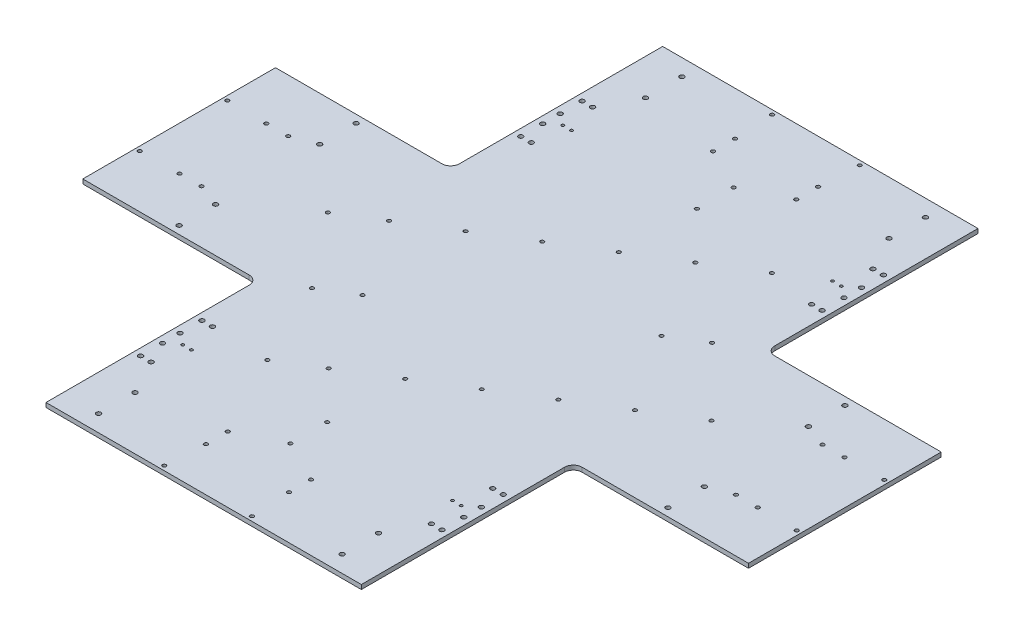
from build123d import *

# Parameters (mm, degrees)
BOSS_EXTRUDE1_DEPTH = 5
SKETCH2_R           = 2.125
CUT_EXTRUDE1_DEPTH  = 3
SKETCH4_R           = 2.6
SKETCH4_R_2         = 1.6
CUT_EXTRUDE3_DEPTH  = 10
SKETCH5_R           = 2.1
CUT_EXTRUDE4_DEPTH  = 10
FILLET1_R           = 10
SKETCH6_R           = 2.6
CUT_EXTRUDE5_DEPTH  = 10
SKETCH7_R           = 2.1
CUT_EXTRUDE6_DEPTH  = 10
SKETCH8_R           = 2.1
CUT_EXTRUDE7_DEPTH  = 10


with BuildPart() as part:
    # Sketch1 → Boss-Extrude1 (new body)
    with BuildSketch(Plane(origin=(0, 0, 0), x_dir=(1, 0, 0), z_dir=(0, 1, 0))):
        Polygon((180, 352), (-180, 352), (-180, 110), (-380, 110), (-380, -110), (-180, -110), (-180, -352), (180, -352), (180, -110), (380, -110), (380, 110), (180, 110), align=None)
    extrude(amount=BOSS_EXTRUDE1_DEPTH)

    # Sketch2 → Cut-Extrude1 (cut)
    with BuildSketch(Plane(origin=(0, 5, 0), x_dir=(1, 0, 0), z_dir=(0, 1, 0))):
        with Locations((330, 49.5)):
            Circle(SKETCH2_R)
        with Locations((305, 49.5)):
            Circle(SKETCH2_R)
        with Locations((305, -49.5)):
            Circle(SKETCH2_R)
        with Locations((330, -49.5)):
            Circle(SKETCH2_R)
        with Locations((-330, -49.5)):
            Circle(SKETCH2_R)
        with Locations((-305, -49.5)):
            Circle(SKETCH2_R)
        with Locations((-305, 49.5)):
            Circle(SKETCH2_R)
        with Locations((-330, 49.5)):
            Circle(SKETCH2_R)
        with Locations((47.5, 302)):
            Circle(SKETCH2_R)
        with Locations((47.5, 277)):
            Circle(SKETCH2_R)
        with Locations((-47.5, 277)):
            Circle(SKETCH2_R)
        with Locations((-47.5, 302)):
            Circle(SKETCH2_R)
        with Locations((-47.5, -302)):
            Circle(SKETCH2_R)
        with Locations((-47.5, -277)):
            Circle(SKETCH2_R)
        with Locations((47.5, -277)):
            Circle(SKETCH2_R)
        with Locations((47.5, -302)):
            Circle(SKETCH2_R)
    extrude(amount=-CUT_EXTRUDE1_DEPTH, mode=Mode.SUBTRACT)

    # Sketch4 → Cut-Extrude3 (cut)
    with BuildSketch(Plane(origin=(0, 5, 0), x_dir=(1, 0, 0), z_dir=(0, 1, 0))):
        with Locations((-172, 182)):
            Circle(SKETCH4_R)
        with Locations((-160, 182)):
            Circle(SKETCH4_R)
        with Locations((-172, 207)):
            Circle(SKETCH4_R)
        with Locations((-172, 227)):
            Circle(SKETCH4_R)
        with Locations((-172, 252)):
            Circle(SKETCH4_R)
        with Locations((-160, 252)):
            Circle(SKETCH4_R)
        with Locations((160, 252)):
            Circle(SKETCH4_R)
        with Locations((172, 252)):
            Circle(SKETCH4_R)
        with Locations((172, 227)):
            Circle(SKETCH4_R)
        with Locations((172, 207)):
            Circle(SKETCH4_R)
        with Locations((160, 182)):
            Circle(SKETCH4_R)
        with Locations((172, 182)):
            Circle(SKETCH4_R)
        with Locations((172, -182)):
            Circle(SKETCH4_R)
        with Locations((160, -182)):
            Circle(SKETCH4_R)
        with Locations((172, -207)):
            Circle(SKETCH4_R)
        with Locations((172, -227)):
            Circle(SKETCH4_R)
        with Locations((172, -252)):
            Circle(SKETCH4_R)
        with Locations((160, -252)):
            Circle(SKETCH4_R)
        with Locations((-160, -252)):
            Circle(SKETCH4_R)
        with Locations((-172, -252)):
            Circle(SKETCH4_R)
        with Locations((-172, -227)):
            Circle(SKETCH4_R)
        with Locations((-172, -207)):
            Circle(SKETCH4_R)
        with Locations((-160, -182)):
            Circle(SKETCH4_R)
        with Locations((-172, -182)):
            Circle(SKETCH4_R)
        with Locations((159, -217)):
            Circle(SKETCH4_R_2)
        with Locations((-159, -217)):
            Circle(SKETCH4_R_2)
        with Locations((159, 217)):
            Circle(SKETCH4_R_2)
        with Locations((-159, 217)):
            Circle(SKETCH4_R_2)
        with Locations((149, -217)):
            Circle(SKETCH4_R_2)
        with Locations((-149, -217)):
            Circle(SKETCH4_R_2)
        with Locations((149, 217)):
            Circle(SKETCH4_R_2)
        with Locations((-149, 217)):
            Circle(SKETCH4_R_2)
    extrude(amount=-CUT_EXTRUDE3_DEPTH, mode=Mode.SUBTRACT)

    # Sketch5 → Cut-Extrude4 (cut)
    with BuildSketch(Plane(origin=(0, 5, 0), x_dir=(1, 0, 0), z_dir=(0, 1, 0))):
        with Locations((-50, 347)):
            Circle(SKETCH5_R)
        with Locations((50, 347)):
            Circle(SKETCH5_R)
        with Locations((50, -347)):
            Circle(SKETCH5_R)
        with Locations((-50, -347)):
            Circle(SKETCH5_R)
        with Locations((-375, 50)):
            Circle(SKETCH5_R)
        with Locations((-375, -50)):
            Circle(SKETCH5_R)
        with Locations((375, -50)):
            Circle(SKETCH5_R)
        with Locations((375, 50)):
            Circle(SKETCH5_R)
    extrude(amount=-CUT_EXTRUDE4_DEPTH, mode=Mode.SUBTRACT)

    # Fillet1
    fillet1_edges = [part.edges().sort_by_distance(p)[0] for p in [
        (-180, 2.5, -110),
        (-180, 2.5, 110),
        (180, 2.5, 110),
        (180, 2.5, -110),
    ]]
    fillet(fillet1_edges, radius=FILLET1_R)

    # Sketch6 → Cut-Extrude5 (cut)
    with BuildSketch(Plane(origin=(0, 5, 0), x_dir=(1, 0, 0), z_dir=(0, 1, 0))):
        with Locations((139, 333)):
            Circle(SKETCH6_R)
        with Locations((139, 291.4)):
            Circle(SKETCH6_R)
        with Locations((139, -291.4)):
            Circle(SKETCH6_R)
        with Locations((139, -333)):
            Circle(SKETCH6_R)
        with Locations((-139, -333)):
            Circle(SKETCH6_R)
        with Locations((-139, -291.4)):
            Circle(SKETCH6_R)
        with Locations((-139, 291.4)):
            Circle(SKETCH6_R)
        with Locations((-139, 333)):
            Circle(SKETCH6_R)
        with Locations((279, 101)):
            Circle(SKETCH6_R)
        with Locations((279, 59.4)):
            Circle(SKETCH6_R)
        with Locations((279, -59.4)):
            Circle(SKETCH6_R)
        with Locations((279, -101)):
            Circle(SKETCH6_R)
        with Locations((-279, -101)):
            Circle(SKETCH6_R)
        with Locations((-279, -59.4)):
            Circle(SKETCH6_R)
        with Locations((-279, 59.4)):
            Circle(SKETCH6_R)
        with Locations((-279, 101)):
            Circle(SKETCH6_R)
    extrude(amount=-CUT_EXTRUDE5_DEPTH, mode=Mode.SUBTRACT)

    # Sketch7 → Cut-Extrude6 (cut)
    with BuildSketch(Plane(origin=(0, 5, 0), x_dir=(1, 0, 0), z_dir=(0, 1, 0))):
        with Locations((-55.682048102, 90.197059371)):
            Circle(SKETCH7_R)
        with Locations((-1.648904044, 123.553757998)):
            Circle(SKETCH7_R)
        with Locations((52.384240013, 156.910456625)):
            Circle(SKETCH7_R)
        with Locations((106.41738407, 190.267155252)):
            Circle(SKETCH7_R)
        with Locations((-109.715192159, 56.840360744)):
            Circle(SKETCH7_R)
        with Locations((-163.748336216, 23.483662117)):
            Circle(SKETCH7_R)
        with Locations((-206.974851462, -3.201696784)):
            Circle(SKETCH7_R)
        with Locations((-95.610755259, -183.595815527)):
            Circle(SKETCH7_R)
        with Locations((-52.384240013, -156.910456625)):
            Circle(SKETCH7_R)
        with Locations((1.648904044, -123.553757998)):
            Circle(SKETCH7_R)
        with Locations((217.781480273, 9.87303651)):
            Circle(SKETCH7_R)
        with Locations((163.748336216, -23.483662117)):
            Circle(SKETCH7_R)
        with Locations((109.715192159, -56.840360744)):
            Circle(SKETCH7_R)
        with Locations((55.682048102, -90.197059371)):
            Circle(SKETCH7_R)
    extrude(amount=-CUT_EXTRUDE6_DEPTH, mode=Mode.SUBTRACT)

    # Sketch8 → Cut-Extrude7 (cut)
    with BuildSketch(Plane(origin=(0, 5, 0), x_dir=(1, 0, 0), z_dir=(0, 1, 0))):
        with Locations((-141.23406512, -87.1891175)):
            Circle(SKETCH8_R)
        with Locations((-105.495607634, -65.126419195)):
            Circle(SKETCH8_R)
        with Locations((105.495607634, 65.126419195)):
            Circle(SKETCH8_R)
        with Locations((141.23406512, 87.1891175)):
            Circle(SKETCH8_R)
        with Locations((0, 253)):
            Circle(SKETCH8_R)
        with Locations((0, 211)):
            Circle(SKETCH8_R)
        with Locations((0, -211)):
            Circle(SKETCH8_R)
        with Locations((0, -253)):
            Circle(SKETCH8_R)
    extrude(amount=-CUT_EXTRUDE7_DEPTH, mode=Mode.SUBTRACT)


solid = part.part
